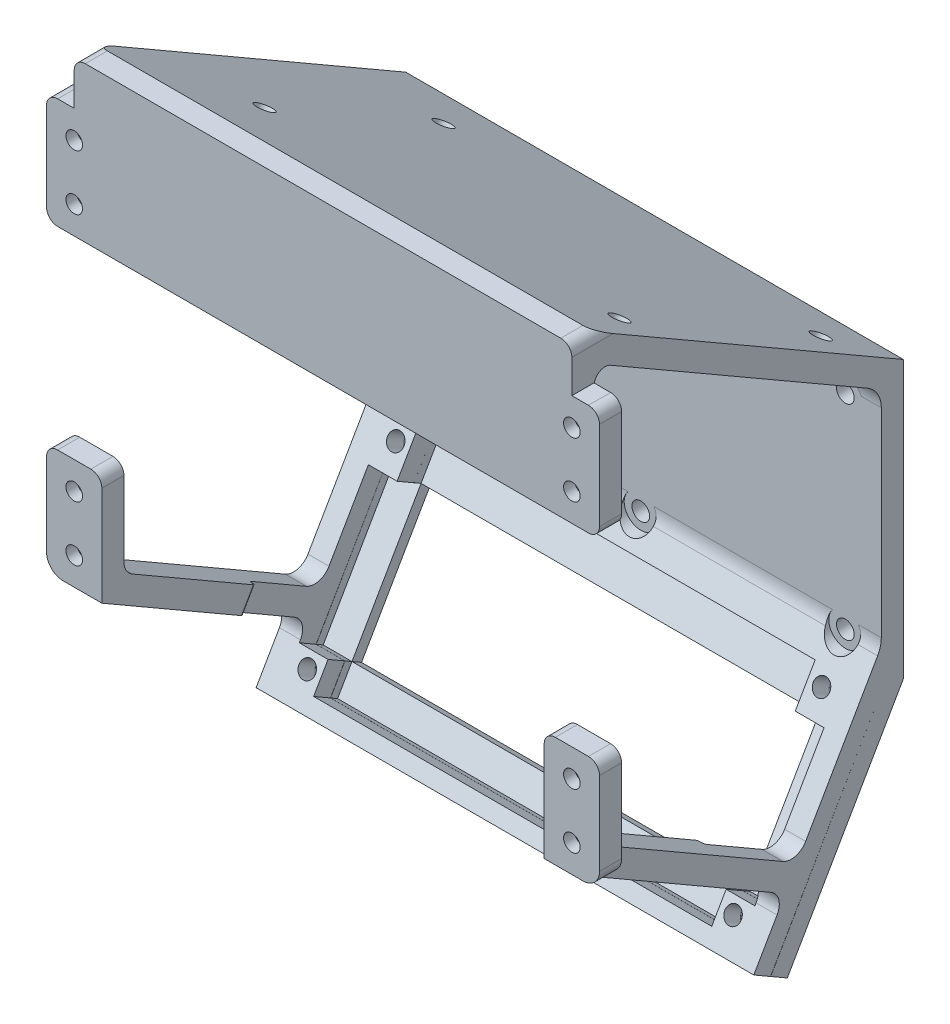
from build123d import *

# Parameters (mm, degrees)
SKETCH_1_R                = 1.5
EXTRUDE_1_DEPTH           = 4
SKETCH_2_R                = 3
CUT_EXTRUDE_1_DEPTH       = 2
EXTRUDE_3_DEPTH           = 4
EXTRUDE_START             = -90
EXTRUDE_4_DEPTH           = 90
CUT_EXTRUDE_START         = -90
CUT_EXTRUDE_2_DEPTH       = 90
EXTRUDE_5_DEPTH           = 4
SKETCH_8_R                = 3
CUT_EXTRUDE_3_DEPTH       = 2
EXTRUDE_6_DEPTH           = 4
EXTRUDE_7_DEPTH           = 5
CUT_EXTRUDE_START_2       = 11
SKETCH_12_R               = 3
CUT_EXTRUDE_4_DEPTH       = 11
FILLET_1_R                = 3
FILLET_2_R                = 2
EXTRUDE_START_2           = -5
EXTRUDE_10_DEPTH          = 5
CUT_EXTRUDE_START_3       = 37
CUT_EXTRUDE_6_DEPTH       = 37
FILLET_3_R                = 2
FILLET_4_R                = 3
SKETCH_17_R               = 1.6
CUT_EXTRUDE_7_DEPTH       = 37
CUT_EXTRUDE_9_DEPTH       = 37
CUT_EXTRUDE_9_DEPTH_BACK  = 37
SKETCH_18_R               = 1.6
SKETCH_19_R               = 3
CUT_EXTRUDE_10_DEPTH      = 27
SKETCH_20_W               = 36
SKETCH_20_H               = 25
CUT_EXTRUDE_15_DEPTH      = 29
SKETCH_24_R               = 1.5
CUT_EXTRUDE_16_DEPTH      = 29
CUT_EXTRUDE_17_DEPTH      = 10
CUT_EXTRUDE_17_DEPTH_BACK = 5
SKETCH_25_W               = 72
SKETCH_25_H               = 7.2
SKETCH_25_H_2             = 25
SKETCH_25_H_3             = 5.2
SKETCH_26_W               = 5.2
SKETCH_26_H               = 25
CUT_EXTRUDE_18_DEPTH      = 20
FILLET_6_R                = 0.5
FILLET_7_R                = 0.5


# Read off the part's stored shape, not the designer's step: 凸台-拉伸4
with BuildPart() as part:
    # 草图1 → 凸台-拉伸1 (new body)
    with BuildSketch(Plane.XY):
        with BuildLine():
            Line((-48, -10), (48, -10))
            ThreePointArc((48, -10), (49.414213562, -9.414213562), (50, -8))
            Line((50, -8), (50, 8))
            ThreePointArc((50, 8), (49.414213562, 9.414213562), (48, 10))
            Line((48, 10), (-48, 10))
            ThreePointArc((-48, 10), (-49.414213562, 9.414213562), (-50, 8))
            Line((-50, 8), (-50, -8))
            ThreePointArc((-50, -8), (-49.414213562, -9.414213562), (-48, -10))
        make_face()
        with Locations((45, 5)):
            Circle(SKETCH_1_R, mode=Mode.SUBTRACT)
        with Locations((45, -5)):
            Circle(SKETCH_1_R, mode=Mode.SUBTRACT)
        with Locations((-45, 5)):
            Circle(SKETCH_1_R, mode=Mode.SUBTRACT)
        with Locations((-45, -5)):
            Circle(SKETCH_1_R, mode=Mode.SUBTRACT)
    extrude(amount=EXTRUDE_1_DEPTH)

    # 草图2 → 切除-拉伸1 (cut)
    with BuildSketch(Plane(origin=(0, 0, 0), x_dir=(-1, 0, 0), z_dir=(0, 0, -1))):
        with Locations((-45, 5)):
            Circle(SKETCH_2_R)
        with Locations((-45, -5)):
            Circle(SKETCH_2_R)
        with Locations((45, 5)):
            Circle(SKETCH_2_R)
        with Locations((45, -5)):
            Circle(SKETCH_2_R)
    extrude(amount=-CUT_EXTRUDE_1_DEPTH, mode=Mode.SUBTRACT)

    # 草图3 → 凸台-拉伸3 (add)
    with BuildSketch(Plane(origin=(0, 0, 0), x_dir=(-1, 0, 0), z_dir=(0, 0, -1))):
        with BuildLine():
            Line((-45, 10), (0, 10))
            Line((0, 10), (45, 10))
            Line((45, 10), (45, 16))
            ThreePointArc((45, 16), (44.414213562, 17.414213562), (43, 18))
            Line((43, 18), (-43, 18))
            ThreePointArc((-43, 18), (-44.414213562, 17.414213562), (-45, 16))
            Line((-45, 16), (-45, 10))
        make_face()
    extrude(amount=-EXTRUDE_3_DEPTH)

    # 凸台-拉伸4 outline → 凸台-拉伸4 (add)
    with BuildSketch(Plane(origin=(45, 0, 0), x_dir=(0, 0, -1), z_dir=(1, 0, 0)).offset(EXTRUDE_START)):
        with BuildLine():
            Line((55.961524227, -14.309401077), (0, 18))
            Line((0, 18), (0, 9.535898385))
            ThreePointArc((0, 9.535898385), (1, 11.267949192), (3, 11.267949192))
            Line((3, 11.267949192), (49.461524227, -15.556624327))
            ThreePointArc((49.461524227, -15.556624327), (51.291651246, -17.386751346), (51.961524227, -19.886751346))
            Line((51.961524227, -19.886751346), (51.961524227, -55.897858345))
            ThreePointArc((51.961524227, -55.897858345), (51.791153359, -57.191953571), (51.291651246, -58.397858345))
            Line((51.291651246, -58.397858345), (28.899354455, -97.182454085))
            Line((28.899354455, -97.182454085), (31.930443368, -98.932454085))
            Line((31.930443368, -98.932454085), (51.961524227, -64.309401077))
            Line((51.961524227, -64.309401077), (31.961532281, -98.950403278))
            Line((31.961532281, -98.950403278), (34.961532281, -100.682454085))
            Line((34.961532281, -100.682454085), (55.961524227, -64.309401077))
            Line((55.961524227, -64.309401077), (55.961524227, -14.309401077))
        make_face()
    extrude(amount=EXTRUDE_4_DEPTH)

    # 草图6 → 切除-拉伸2 (cut)
    with BuildSketch(Plane.XY.offset(4).offset(CUT_EXTRUDE_START)):
        with BuildLine():
            Line((-43, 18), (-45, 18))
            Line((-45, 18), (-45, 16))
            ThreePointArc((-45, 16), (-44.414213562, 17.414213562), (-43, 18))
        make_face()
        with BuildLine():
            Line((45, 18), (45, 16))
            ThreePointArc((45, 16), (44.414213562, 17.414213562), (43, 18))
            Line((43, 18), (45, 18))
        make_face()
    extrude(amount=CUT_EXTRUDE_2_DEPTH, mode=Mode.SUBTRACT)



with BuildPart() as body_2:
    # 草图7 → 凸台-拉伸5 (new body)
    with BuildSketch(Plane.XY.offset(4)):
        with BuildLine():
            Line((-40, -50), (-43.5, -50))
            ThreePointArc((-43.5, -50), (-43.939339828, -51.060660172), (-45, -51.5))
            Line((-45, -51.5), (-45, -58.5))
            ThreePointArc((-45, -58.5), (-43.939339828, -58.939339828), (-43.5, -60))
            Line((-43.5, -60), (-40, -60))
            Line((-40, -60), (-40, -50))
        make_face()
        with BuildLine():
            Line((-42, -45), (-45, -45))
            Line((-45, -45), (-45, -48.5))
            ThreePointArc((-45, -48.5), (-43.939339828, -48.939339828), (-43.5, -50))
            Line((-43.5, -50), (-40, -50))
            Line((-40, -50), (-40, -47))
            ThreePointArc((-40, -47), (-40.585786438, -45.585786438), (-42, -45))
        make_face()
        with BuildLine():
            Line((-45, -48.5), (-45, -45))
            Line((-45, -45), (-48, -45))
            ThreePointArc((-48, -45), (-49.414213562, -45.585786438), (-50, -47))
            Line((-50, -47), (-50, -63))
            ThreePointArc((-50, -63), (-49.414213562, -64.414213562), (-48, -65))
            Line((-48, -65), (-42, -65))
            ThreePointArc((-42, -65), (-40.585786438, -64.414213562), (-40, -63))
            Line((-40, -63), (-40, -60))
            Line((-40, -60), (-43.5, -60))
            ThreePointArc((-43.5, -60), (-46.060660172, -61.060660172), (-45, -58.5))
            Line((-45, -58.5), (-45, -51.5))
            ThreePointArc((-45, -51.5), (-46.5, -50), (-45, -48.5))
        make_face()
        with BuildLine():
            Line((43.5, -60), (40, -60))
            Line((40, -60), (40, -63))
            ThreePointArc((40, -63), (40.585786438, -64.414213562), (42, -65))
            Line((42, -65), (48, -65))
            ThreePointArc((48, -65), (49.414213562, -64.414213562), (50, -63))
            Line((50, -63), (50, -47))
            ThreePointArc((50, -47), (49.414213562, -45.585786438), (48, -45))
            Line((48, -45), (45, -45))
            Line((45, -45), (45, -48.5))
            ThreePointArc((45, -48.5), (46.060660172, -48.939339828), (46.5, -50))
            ThreePointArc((46.5, -50), (46.060660172, -51.060660172), (45, -51.5))
            Line((45, -51.5), (45, -58.5))
            ThreePointArc((45, -58.5), (46.060660172, -58.939339828), (46.5, -60))
            ThreePointArc((46.5, -60), (45, -61.5), (43.5, -60))
        make_face()
        with BuildLine():
            Line((40, -47), (40, -50))
            Line((40, -50), (43.5, -50))
            ThreePointArc((43.5, -50), (43.939339828, -48.939339828), (45, -48.5))
            Line((45, -48.5), (45, -45))
            Line((45, -45), (42, -45))
            ThreePointArc((42, -45), (40.585786438, -45.585786438), (40, -47))
        make_face()
        with BuildLine():
            Line((43.5, -50), (40, -50))
            Line((40, -50), (40, -60))
            Line((40, -60), (43.5, -60))
            ThreePointArc((43.5, -60), (43.939339828, -58.939339828), (45, -58.5))
            Line((45, -58.5), (45, -51.5))
            ThreePointArc((45, -51.5), (43.939339828, -51.060660172), (43.5, -50))
        make_face()
    extrude(amount=-EXTRUDE_5_DEPTH)

    # 草图8 → 切除-拉伸3 (cut)
    with BuildSketch(Plane(origin=(0, 0, 0), x_dir=(-1, 0, 0), z_dir=(0, 0, -1))):
        with Locations((45, -50)):
            Circle(SKETCH_8_R)
        with Locations((45, -60)):
            Circle(SKETCH_8_R)
        with Locations((-45, -50)):
            Circle(SKETCH_8_R)
        with Locations((-45, -60)):
            Circle(SKETCH_8_R)
    extrude(amount=-CUT_EXTRUDE_3_DEPTH, mode=Mode.SUBTRACT)

    # 草图9 → 凸台-拉伸6 (add)
    with BuildSketch(Plane.XY.offset(4)):
        Polygon((-50, -63), (-50, -65), (-48, -65), align=None)
        Polygon((-42, -65), (-40, -63), (-40, -65), align=None)
        with BuildLine():
            Line((48, -65), (50, -65))
            Line((50, -65), (50, -63))
            ThreePointArc((50, -63), (49.414213562, -64.414213562), (48, -65))
        make_face()
        with BuildLine():
            Line((40, -63), (40, -65))
            Line((40, -65), (42, -65))
            ThreePointArc((42, -65), (40.585786438, -64.414213562), (40, -63))
        make_face()
    extrude(amount=-EXTRUDE_6_DEPTH)


with BuildPart() as part_1:
    add(part.part)

    add(body_2.part)  # 凸台-拉伸7 merges body 2
    # 草图11 → 凸台-拉伸7 (add)
    with BuildSketch(Plane.ZY.offset(-40)):
        with BuildLine():
            Line((-36.774927238, -83.541561886), (-34.609927238, -87.291451884))
            Line((-34.609927238, -87.291451884), (-33.109927238, -89.889528096))
            ThreePointArc((-33.109927238, -89.889528096), (-33.409628506, -87.61307096), (-32.011851027, -85.791451884))
            Line((-32.011851027, -85.791451884), (4, -65))
            Line((4, -65), (0, -65))
            Line((0, -65), (0, -60.577496938))
            ThreePointArc((0, -60.577496938), (-0.401923789, -62.077496938), (-1.5, -63.175573149))
            Line((-1.5, -63.175573149), (-34.176851027, -82.041561886))
            ThreePointArc((-34.176851027, -82.041561886), (-36.453308162, -82.341263153), (-38.274927238, -80.943485675))
            Line((-38.274927238, -80.943485675), (-36.774927238, -83.541561886))
        make_face()
    extrude(amount=-EXTRUDE_7_DEPTH)

    # 草图12 → 切除-拉伸4 (cut)
    with BuildSketch(Plane(origin=(0, 0, 0), x_dir=(-1, 0, 0), z_dir=(0, 0, -1)).offset(CUT_EXTRUDE_START_2)):
        with Locations((-45, -60)):
            Circle(SKETCH_12_R)
    extrude(amount=-CUT_EXTRUDE_4_DEPTH, mode=Mode.SUBTRACT)

    # 圆角1
    fillet_1_edges = [part_1.edges().sort_by_distance(p)[0] for p in [
        (50, -65, 2),
    ]]
    fillet(fillet_1_edges, radius=FILLET_1_R)

    # 圆角2
    fillet_2_edges = [part_1.edges().sort_by_distance(p)[0] for p in [
        (45, -65, 2),
    ]]
    fillet(fillet_2_edges, radius=FILLET_2_R - 0.0001)  # a hair under: the kernel refuses the full size

    # 草图13 → 凸台-拉伸10 (add)
    with BuildSketch(Plane(origin=(-40, 0, 0), x_dir=(0, 0, -1), z_dir=(1, 0, 0)).offset(EXTRUDE_START_2)):
        with BuildLine():
            Line((0, -65), (-4, -65))
            Line((-4, -65), (32.011851027, -85.791451884))
            ThreePointArc((32.011851027, -85.791451884), (33.409628506, -87.61307096), (33.109927238, -89.889528096))
            Line((33.109927238, -89.889528096), (33.295828298, -89.567538014))
            Line((33.295828298, -89.567538014), (34.609927238, -87.291451884))
            Line((34.609927238, -87.291451884), (35.609927238, -85.559401077))
            Line((35.609927238, -85.559401077), (36.774927238, -83.541561886))
            Line((36.774927238, -83.541561886), (38.274927238, -80.943485675))
            ThreePointArc((38.274927238, -80.943485675), (36.453308162, -82.341263153), (34.176851027, -82.041561886))
            Line((34.176851027, -82.041561886), (1.5, -63.175573149))
            ThreePointArc((1.5, -63.175573149), (0.401923789, -62.077496938), (0, -60.577496938))
            Line((0, -60.577496938), (0, -62.309547746))
            Line((0, -62.309547746), (0, -65))
        make_face()
    extrude(amount=EXTRUDE_10_DEPTH)

    # 草图16 → 切除-拉伸6 (cut)
    with BuildSketch(Plane(origin=(0, 0, 0), x_dir=(-1, 0, 0), z_dir=(0, 0, -1)).offset(CUT_EXTRUDE_START_3)):
        with BuildLine():
            ThreePointArc((45, -63), (47.121320344, -62.121320344), (48, -60))
            ThreePointArc((48, -60), (44.709891884, -57.014060067), (42.056108479, -60.577496938))
            ThreePointArc((42.056108479, -60.577496938), (43.093759041, -62.31651579), (45, -63))
        make_face()
    extrude(amount=-CUT_EXTRUDE_6_DEPTH, mode=Mode.SUBTRACT)

    # 圆角3
    fillet_3_edges = [part_1.edges().sort_by_distance(p)[0] for p in [
        (-45, -65, 2),
    ]]
    fillet(fillet_3_edges, radius=FILLET_3_R)

    # 圆角4
    fillet_4_edges = [part_1.edges().sort_by_distance(p)[0] for p in [
        (-50, -65, 2),
    ]]
    fillet(fillet_4_edges, radius=FILLET_4_R - 0.0001)  # a hair under: the kernel refuses the full size

    # 草图17 → 切除-拉伸7 (cut)
    with BuildSketch(Plane(origin=(0, 9.75, -5.629165125), x_dir=(1, 0, 0), z_dir=(0, -0.86602540378444, 0.49999999999999784))):
        with Locations(Location((-27.2, -5.563248654, 0), (0, 0, 270))):
            Circle(SKETCH_17_R)
        with Locations(Location((-27.2, -42.963248654, 0), (0, 0, 270))):
            Circle(SKETCH_17_R)
        with Locations(Location((39, -3.254957046, 0), (0, 0, 270))):
            Circle(SKETCH_17_R)
        with Locations(Location((39, -45.271540262, 0), (0, 0, 270))):
            Circle(SKETCH_17_R)
    extrude(amount=-CUT_EXTRUDE_7_DEPTH, mode=Mode.SUBTRACT)

    # 草图18 → 切除-拉伸9 (cut, two sides: drawn at the far end of the back side and taken through both)
    with BuildSketch(Plane.XY.offset(-51.961524227).offset(-CUT_EXTRUDE_9_DEPTH_BACK)):
        with Locations(Location((38.5, -20.809401077, 0), (0, 0, 144.784308704))):
            Circle(SKETCH_18_R)
        with Locations(Location((38.5, -57.809401077, 0), (0, 0, 201.579126031))):
            Circle(SKETCH_18_R)
        with Locations(Location((1.5, -57.809401077, 0), (0, 0, 201.579126031))):
            Circle(SKETCH_18_R)
        with Locations(Location((1.5, -20.809401077, 0), (0, 0, 144.784308704))):
            Circle(SKETCH_18_R)
    extrude(amount=CUT_EXTRUDE_9_DEPTH + CUT_EXTRUDE_9_DEPTH_BACK, mode=Mode.SUBTRACT)

    # 草图19 → 切除-拉伸10 (cut)
    with BuildSketch(Plane.XY.offset(-51.961524227)):
        with Locations((1.5, -20.809401077)):
            Circle(SKETCH_19_R)
        with Locations((38.5, -20.809401077)):
            Circle(SKETCH_19_R)
        with Locations((1.5, -57.809401077)):
            Circle(SKETCH_19_R)
        with Locations((38.5, -57.809401077)):
            Circle(SKETCH_19_R)
    extrude(amount=CUT_EXTRUDE_10_DEPTH, mode=Mode.SUBTRACT)

    # 草图20 → 切除-拉伸15 (cut)
    with BuildSketch(Plane(origin=(0, -40.309401077, -69.817930688), x_dir=(-1, 0, 0), z_dir=(0, -0.5000000000000014, -0.8660254037844379))):
        with Locations((18, -49.212796812)):
            Rectangle(SKETCH_20_W, SKETCH_20_H)
        with Locations((-18, -49.212796812)):
            Rectangle(SKETCH_20_W, SKETCH_20_H)
    extrude(amount=-CUT_EXTRUDE_15_DEPTH, mode=Mode.SUBTRACT)

    # 草图24 → 切除-拉伸16 (cut)
    with BuildSketch(Plane(origin=(0, -36.809401077, -63.755752861), x_dir=(1, 0, 0), z_dir=(0, 0.4999999999999985, 0.8660254037844396))):
        with Locations(Location((-38.5, -32.212796812, 0), (0, 0, 270))):
            Circle(SKETCH_24_R)
        with Locations(Location((-38.5, -64.212796812, 0), (0, 0, 270))):
            Circle(SKETCH_24_R)
        with Locations(Location((38.5, -32.212796812, 0), (0, 0, 270))):
            Circle(SKETCH_24_R)
        with Locations(Location((38.5, -64.212796812, 0), (0, 0, 270))):
            Circle(SKETCH_24_R)
    extrude(amount=-CUT_EXTRUDE_16_DEPTH, mode=Mode.SUBTRACT)

    # 草图25 → 切除-拉伸17 (cut, two sides: drawn at the far end of the back side and taken through both)
    with BuildSketch(Plane(origin=(0, -36.809401077, -63.755752861), x_dir=(1, 0, 0), z_dir=(0, 0.4999999999999985, 0.8660254037844396)).offset(-CUT_EXTRUDE_17_DEPTH_BACK)):
        with Locations((0, -33.112796812)):
            Rectangle(SKETCH_25_W, SKETCH_25_H)
        with Locations((0, -49.212796812)):
            Rectangle(SKETCH_25_W, SKETCH_25_H_2)
        Polygon((-36, -61.712796812), (-36, -36.712796812), (-41.2, -36.712796812), (-41.2, -50.961651246), (-40, -50.961651246), (-40, -61.291651246), (-41.2, -61.291651246), (-41.2, -61.712796812), align=None)
        Polygon((41.2, -36.712796812), (36, -36.712796812), (36, -61.712796812), (41.2, -61.712796812), (41.2, -61.291651246), (40, -61.291651246), (40, -50.961651246), (41.2, -50.961651246), align=None)
        with Locations((0, -64.312796812)):
            Rectangle(SKETCH_25_W, SKETCH_25_H_3)
    extrude(amount=CUT_EXTRUDE_17_DEPTH + CUT_EXTRUDE_17_DEPTH_BACK, mode=Mode.SUBTRACT)

    # 草图26 → 切除-拉伸18 (cut)
    with BuildSketch(Plane(origin=(0, -39.309401077, -68.08587988), x_dir=(1, 0, 0), z_dir=(0, 0.49999999999999856, 0.8660254037844396))):
        with Locations((-38.6, -49.212796812)):
            Rectangle(SKETCH_26_W, SKETCH_26_H)
        with Locations((38.6, -49.212796812)):
            Rectangle(SKETCH_26_W, SKETCH_26_H)
    extrude(amount=CUT_EXTRUDE_18_DEPTH, mode=Mode.SUBTRACT)

    # 圆角6
    fillet_6_edges = [part_1.edges().sort_by_distance(p)[0] for p in [
        (40, -77.916506885, -22.702046181),
        (41.2, -77.916506885, -22.702046181),
    ]]
    fillet(fillet_6_edges, radius=FILLET_6_R)

    # 圆角7
    fillet_7_edges = [part_1.edges().sort_by_distance(p)[0] for p in [
        (-40, -77.916506885, -22.702046181),
        (-41.2, -77.916506885, -22.702046181),
    ]]
    fillet(fillet_7_edges, radius=FILLET_7_R)


solid = part_1.part
